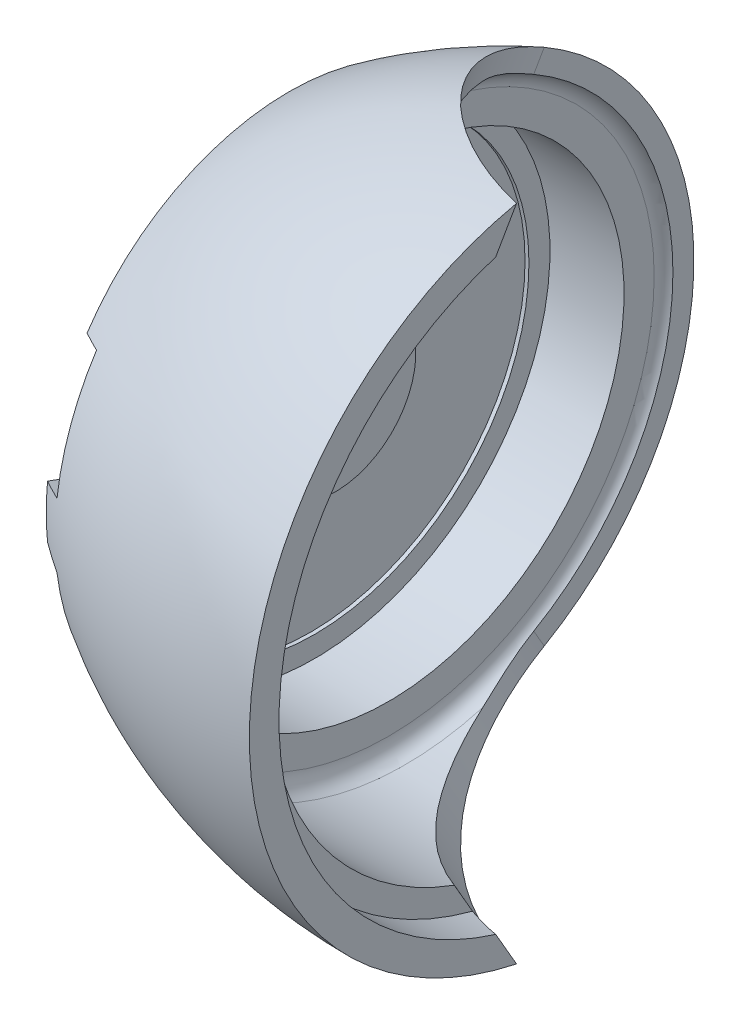
from build123d import *

# Parameters (mm, degrees)
FILLET1_R          = 2.54
SKETCH9_R          = 35.052
CUT_EXTRUDE4_DEPTH = 57.912
SKETCH10_W         = 58.015232171
SKETCH10_H         = 28.829548031
CUT_REVOLVE2_ANGLE = 120
CUT_EXTRUDE5_START = -31.75
SKETCH11_W         = 5.08
SKETCH11_H         = 17.78
CUT_EXTRUDE5_DEPTH = 31.75
FILLET2_R          = 2.54


with BuildPart() as part:
    # Sketch1 → Revolve1 (revolve)
    with BuildSketch(Plane.XY):
        with BuildLine():
            Line((-39.088, 0), (-39.088, 12.4))
            Line((-39.088, 12.4), (-42.39, 12.4))
            Line((-42.39, 12.4), (-42.9, 12.4))
            Line((-42.9, 12.4), (-42.9, 33.02))
            Line((-42.9, 33.02), (-42.3, 33.02))
            Line((-42.3, 33.02), (-42.3, 36.2585))
            Line((-42.3, 36.2585), (-30.9, 36.2585))
            Line((-30.9, 36.2585), (-30.9, 43.434))
            Line((-30.9, 43.434), (-5.909999996, 43.434))
            Line((-5.909999996, 43.434), (-5.909999996, 47.244))
            Line((-5.909999996, 47.244), (-0.509999996, 47.244))
            Line((-0.509999996, 47.244), (-0.509999996, 51.81439996))
            ThreePointArc((-0.509999996, 51.81439996), (-24.440435702, 48.054407509), (-46.2, 37.409002026))
            Line((-46.2, 37.409002026), (-46.2, 8.59))
            Line((-46.2, 8.59), (-42.988, 8.59))
            Line((-42.988, 8.59), (-42.988, 0))
            Line((-42.988, 0), (-39.088, 0))
        make_face()
    revolve(axis=Axis((-42.988, 0, 0), (1, 0, 0)))

    # Fillet1
    fillet1_edges = [part.edges().sort_by_distance(p)[0] for p in [
        (-30.9, -43.434, 0),
    ]]
    fillet(fillet1_edges, radius=FILLET1_R)

    # Sketch9 → Cut-Extrude4 (cut)
    with BuildSketch(Plane(origin=(0, 0, 0), x_dir=(1, 0, 0), z_dir=(0, -0.8660254037844416, 0.49999999999999495))):
        with Locations((5.08, 0)):
            Circle(SKETCH9_R)
    cut_extrude4 = extrude(amount=-CUT_EXTRUDE4_DEPTH, mode=Mode.SUBTRACT)

    # Mirror3: Cut-Extrude4 across plane
    add(cut_extrude4.mirror(Plane.ZX), mode=Mode.SUBTRACT)

    # Sketch10 → Cut-Revolve2 (revolve, cut)
    with BuildSketch(Plane(origin=(0, 0, 0), x_dir=(1, 0, 0), z_dir=(0, -0.49999999999999495, -0.8660254037844416))):
        with Locations((-0.964383914, -42.303173001)):
            Rectangle(SKETCH10_W, SKETCH10_H)
    revolve(axis=Axis((-48.7934, 0, 0), (-1, 0, 0)), revolution_arc=CUT_REVOLVE2_ANGLE, mode=Mode.SUBTRACT)

    # Sketch11 → Cut-Extrude5 (cut)
    with BuildSketch(Plane(origin=(0, 0, 0), x_dir=(1, 0, 0), z_dir=(0, -0.34202014332565933, -0.9396926207859118)).offset(CUT_EXTRUDE5_START)):
        with Locations((-44.84, 0)):
            Rectangle(SKETCH11_W, SKETCH11_H)
    cut_extrude5 = extrude(amount=-CUT_EXTRUDE5_DEPTH, mode=Mode.SUBTRACT)

    # Fillet2
    fillet2_edges = [part.edges().sort_by_distance(p)[0] for p in [
        (-42.9, 10.859139551, 29.83524071),
    ]]
    fillet(fillet2_edges, radius=FILLET2_R)

    # Mirror4: Cut-Extrude5 across plane
    add(cut_extrude5.mirror(Plane.ZX), mode=Mode.SUBTRACT)


solid = part.part
